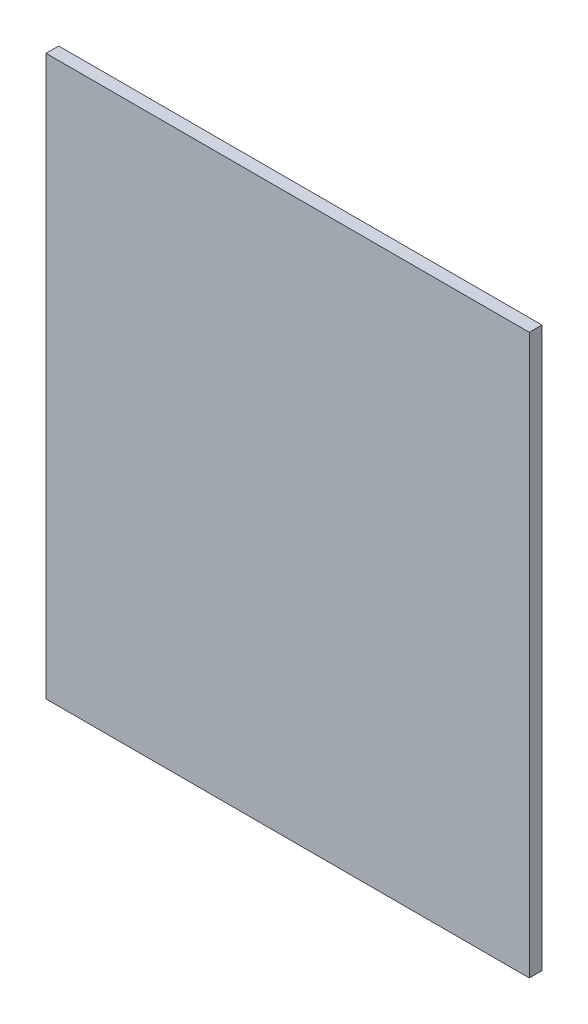
from build123d import *

# Parameters (mm, degrees)
SKETCH1_W           = 191
SKETCH1_H           = 221
BOSS_EXTRUDE1_DEPTH = 5


with BuildPart() as part:
    # Sketch1 → Boss-Extrude1 (new body)
    with BuildSketch(Plane.XY):
        Rectangle(SKETCH1_W, SKETCH1_H)
    extrude(amount=BOSS_EXTRUDE1_DEPTH)


solid = part.part
